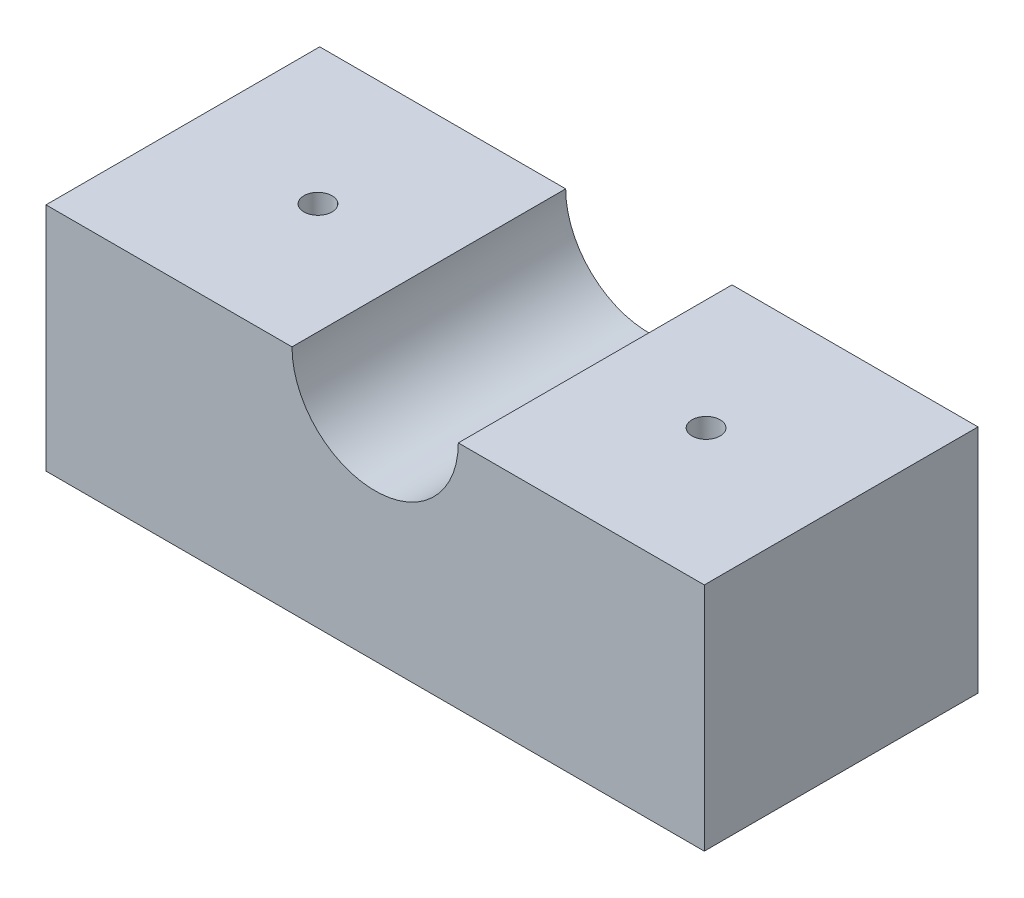
from build123d import *

# Parameters (mm, degrees)
SKETCH2_W           = 23.74600026
SKETCH2_H           = 9.873000066
BOSS_EXTRUDE1_DEPTH = 8.3185
SKETCH3_R           = 2.99974
CUT_EXTRUDE1_DEPTH  = 18.539717918
SKETCH4_R           = 0.508
CUT_EXTRUDE2_DEPTH  = 2.54


with BuildPart() as part:
    # Sketch2 → Boss-Extrude1 (new body)
    with BuildSketch(Plane(origin=(0, 0, 0), x_dir=(1, 0, 0), z_dir=(0, 1, 0))):
        Rectangle(SKETCH2_W, SKETCH2_H)
    extrude(amount=BOSS_EXTRUDE1_DEPTH)

    # Sketch3 → Cut-Extrude1 (cut, through all)
    with BuildSketch(Plane.XY.offset(4.936500033)):
        with Locations((0, 8.3185)):
            Circle(SKETCH3_R)
    extrude(amount=-CUT_EXTRUDE1_DEPTH, mode=Mode.SUBTRACT)

    # Sketch4 → Cut-Extrude2 (cut)
    with BuildSketch(Plane(origin=(0, 8.3185, 0), x_dir=(1, 0, 0), z_dir=(0, 1, 0))):
        with Locations((-6.99999997, 0)):
            Circle(SKETCH4_R)
        with Locations((6.99999997, 0)):
            Circle(SKETCH4_R)
    extrude(amount=-CUT_EXTRUDE2_DEPTH, mode=Mode.SUBTRACT)


solid = part.part
